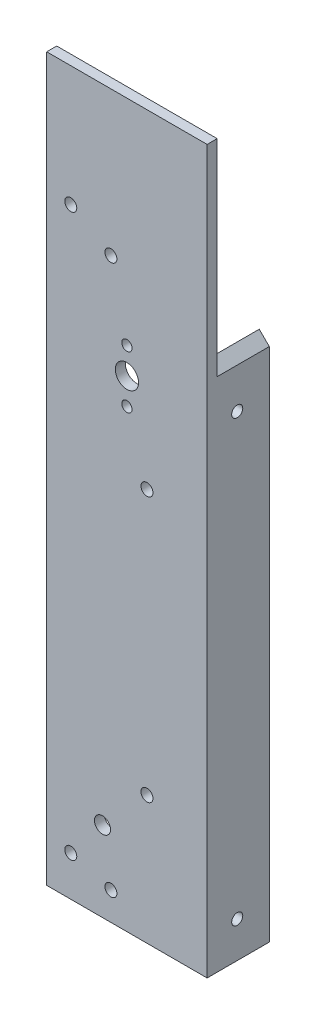
from build123d import *

# Parameters (mm, degrees)
BOSS_EXTRUDE1_DEPTH = 203.2
CUT_EXTRUDE2_DEPTH  = 211.376755429
SKETCH5_R           = 3.683
SKETCH5_R_2         = 1.63195
CUT_EXTRUDE3_DEPTH  = 211.376755429
SKETCH6_R           = 1.7526
CUT_EXTRUDE4_DEPTH  = 211.376755429
SKETCH8_R           = 1.89865
CUT_EXTRUDE5_DEPTH  = 211.103450947
SKETCH9_R           = 1.89865
CUT_EXTRUDE6_DEPTH  = 211.103450947
BOSS_EXTRUDE2_DEPTH = 3.175
SKETCH11_R          = 2.54
CUT_EXTRUDE7_DEPTH  = 236.002338765
SKETCH12_R          = 1.89865
CUT_EXTRUDE8_DEPTH  = 235.757705092


with BuildPart() as part:
    # Sketch1 → Boss-Extrude1 (new body)
    with BuildSketch(Plane(origin=(0, 0, 0), x_dir=(1, 0, 0), z_dir=(0, 1, 0))):
        Polygon((0, 0), (-50.8, 0), (-50.8, 3.175), (-3.175, 3.175), (-3.175, 19.685), (0, 19.685), align=None)
    extrude(amount=BOSS_EXTRUDE1_DEPTH)

    # Sketch4 → Cut-Extrude2 (cut, through all)
    with BuildSketch(Plane.XY):
        Polygon((-50.8, 214.122), (-57.250524058, 214.122), (-57.250524058, 247.071987418), (14.491605927, 247.071987418), (14.491605927, 163.322), (0, 163.322), align=None)
    extrude(amount=-CUT_EXTRUDE2_DEPTH, mode=Mode.SUBTRACT)

    # Sketch5 → Cut-Extrude3 (cut, through all)
    with BuildSketch(Plane.XY):
        with Locations((-25.4, 152.4)):
            Circle(SKETCH5_R)
        with Locations((-25.4, 160.782)):
            Circle(SKETCH5_R_2)
        with Locations((-25.4, 144.018)):
            Circle(SKETCH5_R_2)
    extrude(amount=-CUT_EXTRUDE3_DEPTH, mode=Mode.SUBTRACT)

    # Sketch6 → Cut-Extrude4 (cut, through all)
    with BuildSketch(Plane(origin=(0, 0, 0), x_dir=(0, 0, -1), z_dir=(1, 0, 0))):
        with Locations((9.530474513, 11.43)):
            Circle(SKETCH6_R)
        with Locations((9.530474513, 150.622)):
            Circle(SKETCH6_R)
    extrude(amount=-CUT_EXTRUDE4_DEPTH, mode=Mode.SUBTRACT)

    # Sketch8 → Cut-Extrude5 (cut, through all)
    with BuildSketch(Plane(origin=(0, 0, -3.175), x_dir=(-1, 0, 0), z_dir=(0, 0, -1))):
        with Locations((30.48, 8.89)):
            Circle(SKETCH8_R)
        with Locations((30.48, 182.88)):
            Circle(SKETCH8_R)
    extrude(amount=-CUT_EXTRUDE5_DEPTH, mode=Mode.SUBTRACT)

    # Sketch9 → Cut-Extrude6 (cut, through all)
    with BuildSketch(Plane(origin=(0, 0, -3.175), x_dir=(-1, 0, 0), z_dir=(0, 0, -1))):
        with Locations((19.05, 40.64)):
            Circle(SKETCH9_R)
        with Locations((19.05, 124.46)):
            Circle(SKETCH9_R)
    extrude(amount=-CUT_EXTRUDE6_DEPTH, mode=Mode.SUBTRACT)

    # Sketch10 → Boss-Extrude2 (add)
    with BuildSketch(Plane.XY):
        Polygon((0, 228.6), (0, 163.322), (-39.878, 203.2), (-50.8, 203.2), (-50.8, 228.6), align=None)
    extrude(amount=-BOSS_EXTRUDE2_DEPTH)

    # Sketch11 → Cut-Extrude7 (cut, through all)
    with BuildSketch(Plane.XY):
        with Locations((-33.136196499, 25.4)):
            Circle(SKETCH11_R)
    extrude(amount=-CUT_EXTRUDE7_DEPTH, mode=Mode.SUBTRACT)

    # Sketch12 → Cut-Extrude8 (cut, through all)
    with BuildSketch(Plane(origin=(0, 0, -3.175), x_dir=(-1, 0, 0), z_dir=(0, 0, -1))):
        with Locations((43.18, 12.7)):
            Circle(SKETCH12_R)
        with Locations((43.18, 190.498941664)):
            Circle(SKETCH12_R)
    extrude(amount=-CUT_EXTRUDE8_DEPTH, mode=Mode.SUBTRACT)


solid = part.part
